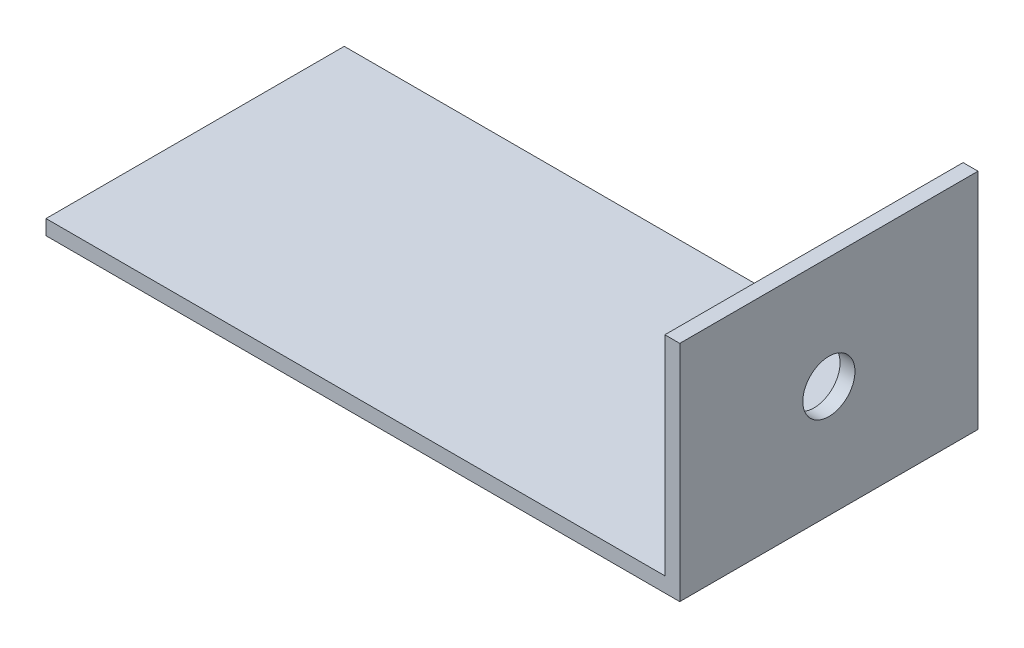
from build123d import *

# Parameters (mm, degrees)
SALIENTE_EXTRUIR1_DEPTH = 40
CROQUIS2_R              = 3.5
CORTAR_EXTRUIR1_DEPTH   = 99.077964122


with BuildPart() as part:
    # Croquis1 → Saliente-Extruir1 (new body)
    with BuildSketch(Plane.XY):
        Polygon((0.551367026, 28.183098592), (0.551367026, -1.816901408), (-84.448632974, -1.816901408), (-84.448632974, 0.183098592), (-1.448632974, 0.183098592), (-1.448632974, 28.183098592), align=None)
    extrude(amount=SALIENTE_EXTRUIR1_DEPTH)

    # Croquis2 → Cortar-Extruir1 (cut, through all)
    with BuildSketch(Plane(origin=(0.551367026, 0, 0), x_dir=(0, 0, -1), z_dir=(1, 0, 0))):
        with Locations((-20, 13.183098592)):
            Circle(CROQUIS2_R)
    extrude(amount=-CORTAR_EXTRUIR1_DEPTH, mode=Mode.SUBTRACT)


solid = part.part
